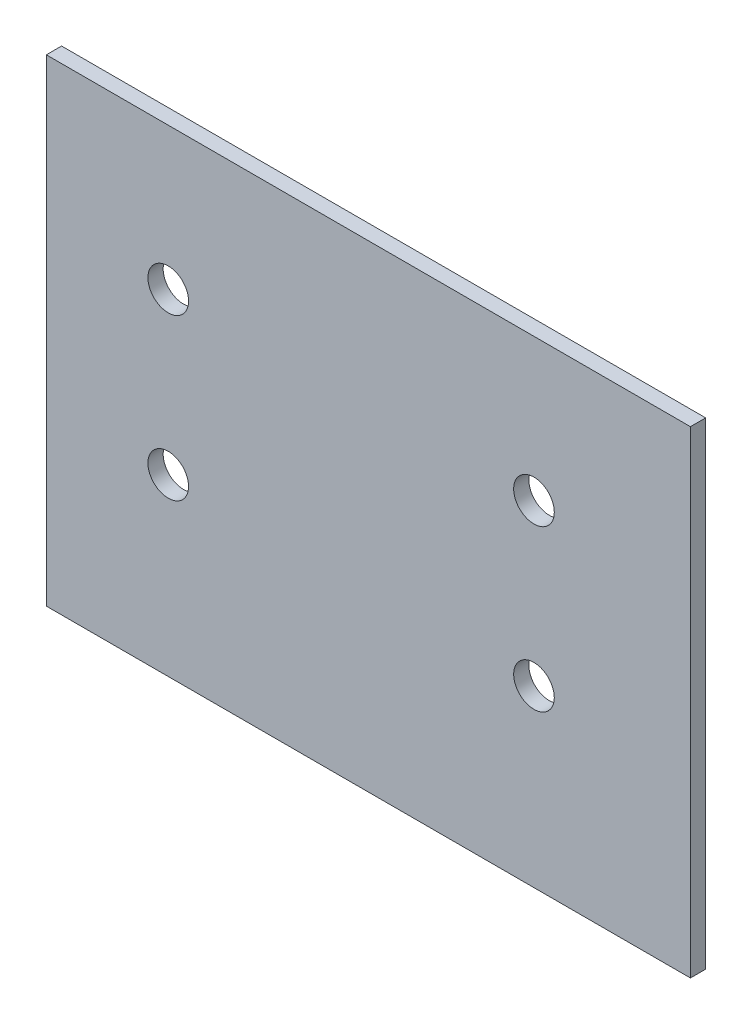
from build123d import *

# Parameters (mm, degrees)
SKETCH1_W           = 80.518
SKETCH1_H           = 59.69
BOSS_EXTRUDE1_DEPTH = 1.905
SKETCH2_R           = 2.54
CUT_EXTRUDE1_DEPTH  = 51.151172778


with BuildPart() as part:
    # Sketch1 → Boss-Extrude1 (new body)
    with BuildSketch(Plane.XY):
        Rectangle(SKETCH1_W, SKETCH1_H)
    extrude(amount=BOSS_EXTRUDE1_DEPTH)

    # Sketch2 → Cut-Extrude1 (cut, through all)
    with BuildSketch(Plane.XY.offset(1.905)):
        with Locations((-25.019, 12.065)):
            Circle(SKETCH2_R)
        with Locations((-25.019, -8.001)):
            Circle(SKETCH2_R)
        with Locations((20.701, 12.065)):
            Circle(SKETCH2_R)
        with Locations((20.701, -8.001)):
            Circle(SKETCH2_R)
    extrude(amount=-CUT_EXTRUDE1_DEPTH, mode=Mode.SUBTRACT)


solid = part.part
